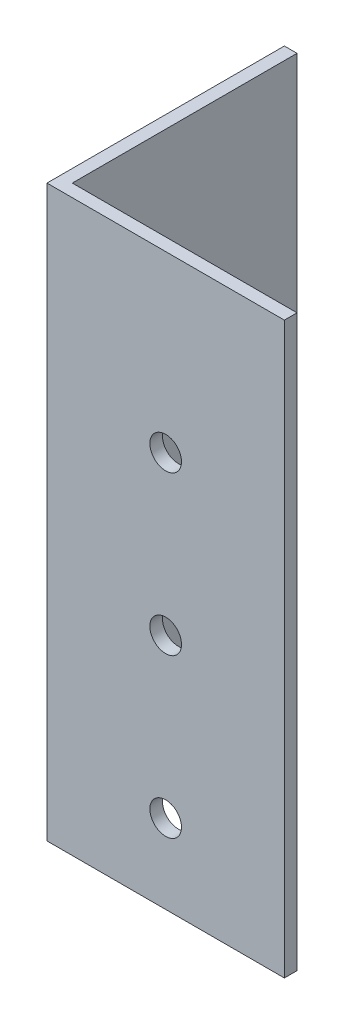
from build123d import *

# Parameters (mm, degrees)
EXTRUDE_1_DEPTH     = 180
SKETCH_6_R          = 5
CUT_EXTRUDE_1_DEPTH = 10


with BuildPart() as part:
    # Эскиз1 → Вытянуть-Тонкостенный1 (new body)
    with BuildSketch(Plane(origin=(0, 0, 0), x_dir=(1, 0, 0), z_dir=(0, 1, 0))):
        Polygon((0, 75), (0, 0), (75, 0), (75, 4), (4, 4), (4, 75), align=None)
    extrude(amount=EXTRUDE_1_DEPTH)

    # Эскиз6 → Вырез-Вытянуть1 (cut)
    with BuildSketch(Plane(origin=(0, 0, 0), x_dir=(-1, 0, 0), z_dir=(0, 0, -1))):
        with Locations((-37.5, 25)):
            Circle(SKETCH_6_R)
        with Locations((-37.5, 75)):
            Circle(SKETCH_6_R)
        with Locations((-37.5, 125)):
            Circle(SKETCH_6_R)
    extrude(amount=CUT_EXTRUDE_1_DEPTH, mode=Mode.SUBTRACT)


solid = part.part
